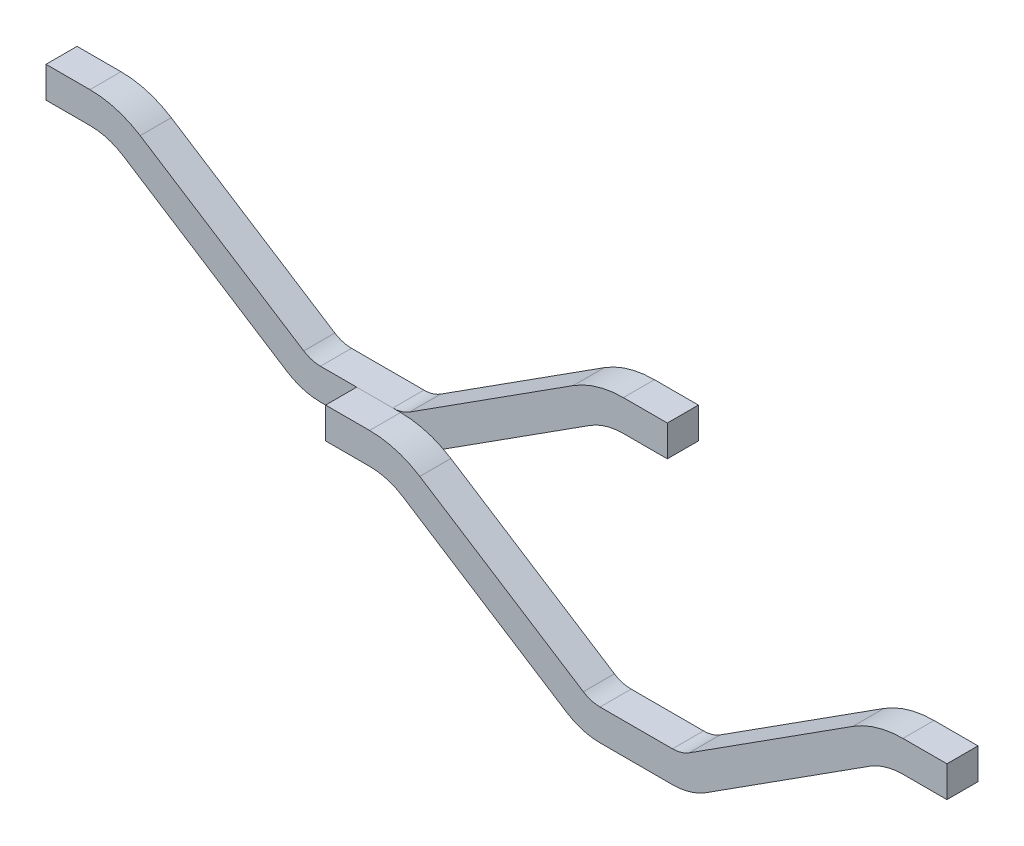
from build123d import *

# Parameters (mm, degrees)
EXTRUDE_THIN2_DEPTH   = 1
SKETCH_PATTERN3_DEPTH = 1


# Read off the part's stored shape, not the designer's step: Sketch-Pattern3
with BuildPart() as part:
    # Sketch1 → Extrude-Thin2 (new body)
    with BuildSketch(Plane.XY):
        with BuildLine():
            Line((-10, 0.02027027), (-8.58520552, 0.02027027))
            ThreePointArc((-8.58520552, 0.02027027), (-8.023549755, -0.060213436), (-7.507098127, -0.295186928))
            Line((-7.507098127, -0.295186928), (-2.242901873, -3.664272531))
            ThreePointArc((-2.242901873, -3.664272531), (-1.726450245, -3.899246023), (-1.16479448, -3.97972973))
            Line((-1.16479448, -3.97972973), (1.16479448, -3.97972973))
            ThreePointArc((1.16479448, -3.97972973), (1.726450245, -3.899246023), (2.242901873, -3.664272531))
            Line((2.242901873, -3.664272531), (7.507098127, -0.295186928))
            ThreePointArc((7.507098127, -0.295186928), (8.023549755, -0.060213436), (8.58520552, 0.02027027))
            Line((8.58520552, 0.02027027), (10, 0.02027027))
            Line((10, 0.02027027), (10, 1.02027027))
            Line((10, 1.02027027), (8.58520552, 1.02027027))
            ThreePointArc((8.58520552, 1.02027027), (7.742721872, 0.899544711), (6.968044431, 0.547084472))
            Line((6.968044431, 0.547084472), (1.703848177, -2.82200113))
            ThreePointArc((1.703848177, -2.82200113), (1.445622363, -2.939487877), (1.16479448, -2.97972973))
            Line((1.16479448, -2.97972973), (-1.16479448, -2.97972973))
            ThreePointArc((-1.16479448, -2.97972973), (-1.445622363, -2.939487877), (-1.703848177, -2.82200113))
            Line((-1.703848177, -2.82200113), (-6.968044431, 0.547084472))
            ThreePointArc((-6.968044431, 0.547084472), (-7.742721872, 0.899544711), (-8.58520552, 1.02027027))
            Line((-8.58520552, 1.02027027), (-10, 1.02027027))
            Line((-10, 1.02027027), (-10, 0.02027027))
        make_face()
    extrude(amount=EXTRUDE_THIN2_DEPTH)


with BuildPart() as body_2:
    # Sketch-Pattern3 outline → Sketch-Pattern3 (new body)
    with BuildSketch(Plane.XY):
        with BuildLine():
            Line((-8.83520552, 1.02027027), (-11.16479448, 1.02027027))
            ThreePointArc((-11.16479448, 1.02027027), (-11.445622363, 1.060512123), (-11.703848177, 1.17799887))
            Line((-11.703848177, 1.17799887), (-16.968044431, 4.547084472))
            ThreePointArc((-16.968044431, 4.547084472), (-17.742721872, 4.899544711), (-18.58520552, 5.02027027))
            Line((-18.58520552, 5.02027027), (-20, 5.02027027))
            Line((-20, 5.02027027), (-20, 4.02027027))
            Line((-20, 4.02027027), (-18.58520552, 4.02027027))
            ThreePointArc((-18.58520552, 4.02027027), (-18.023549755, 3.939786564), (-17.507098127, 3.704813072))
            Line((-17.507098127, 3.704813072), (-12.242901873, 0.335727469))
            ThreePointArc((-12.242901873, 0.335727469), (-11.726450245, 0.100753977), (-11.16479448, 0.02027027))
            Line((-11.16479448, 0.02027027), (-8.83520552, 0.02027027))
            ThreePointArc((-8.83520552, 0.02027027), (-8.273549755, 0.100753977), (-7.757098127, 0.335727469))
            Line((-7.757098127, 0.335727469), (-2.492901873, 3.704813072))
            ThreePointArc((-2.492901873, 3.704813072), (-1.976450245, 3.939786564), (-1.41479448, 4.02027027))
            Line((-1.41479448, 4.02027027), (0, 4.02027027))
            Line((0, 4.02027027), (0, 5.02027027))
            Line((0, 5.02027027), (-1.41479448, 5.02027027))
            ThreePointArc((-1.41479448, 5.02027027), (-2.257278128, 4.899544711), (-3.031955569, 4.547084472))
            Line((-3.031955569, 4.547084472), (-8.296151823, 1.17799887))
            ThreePointArc((-8.296151823, 1.17799887), (-8.554377637, 1.060512123), (-8.83520552, 1.02027027))
        make_face()
    extrude(amount=SKETCH_PATTERN3_DEPTH)


with BuildPart() as body_2_1:
    # Body-Move/Copy1: moved
    add(body_2.part.moved(Location((0, 0, -1))))


solid = Compound([part.part, body_2_1.part])
